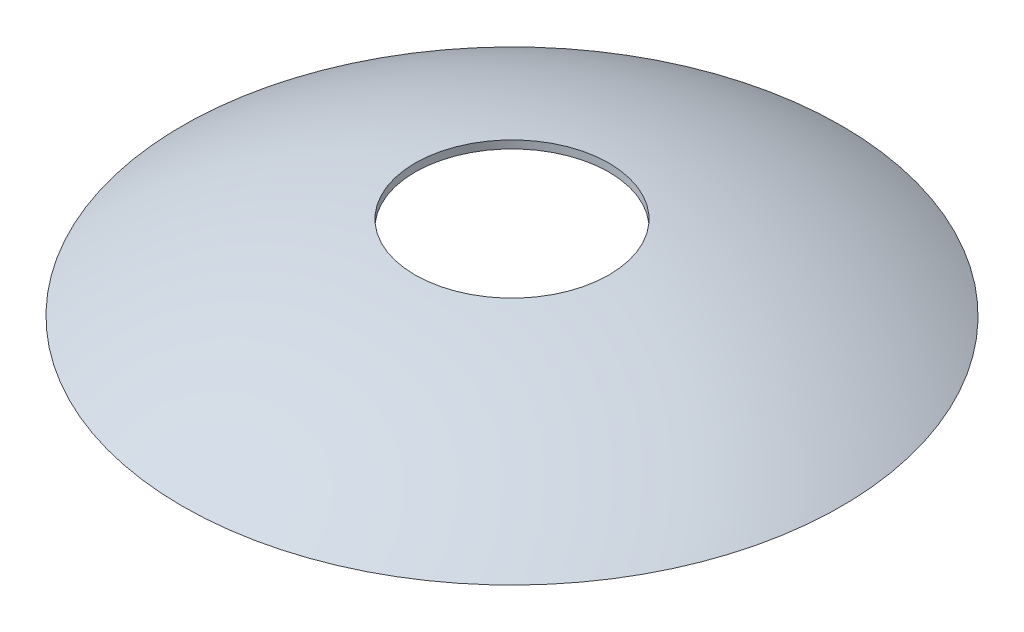
from build123d import *

# Parameters (mm, degrees)
SKETCH4_R          = 25
CUT_EXTRUDE1_DEPTH = 37.574958191


# Read off the part's stored shape, not the designer's step: Shell4
with BuildPart() as part:
    # Sketch2 → Revolve3 (revolve)
    with BuildSketch(Plane.XY):
        with BuildLine():
            ThreePointArc((-85, 0), (-44.249157481, 17.892673888), (0, 22.666666667))
            Line((0, 22.666666667), (0, 0))
            Line((0, 0), (-85, 0))
        make_face()
    revolve(axis=Axis((0, 22.666666667, 0), (0, -1, 0)))

    # Shell4 outline → Shell4 (revolve, cut)
    with BuildSketch(Plane.XY):
        with BuildLine():
            Line((0, 0), (81.209332356, 0))
            add(Edge.make_bspline(
                [(81.209332356, 0), (68.010422844, 7.99521566), (53.461432942, 14.388290113), (37.997575401, 18.722433384), (22.188288082, 20.818693148), (5.322203728, 20.818693133), (3.987860722, 20.803180878), (2.655815078, 20.772246575), (1.326414656, 20.725996375), (0, 20.664551338)],
                knots=[1.026160926, 1.026160926, 1.026160926, 1.026160926, 1.026160926, 1.026160926, 1.570268783, 1.570268783, 1.570268783, 1.570268783, 1.617087387, 1.617087387, 1.617087387, 1.617087387, 1.617087387, 1.617087387], degree=5, weights=[1, 1, 0.999461009, 0.999454119, 1, 1, 0.999999976, 0.999999977, 1, 1]))
            Line((0, 20.664551338), (0, 0))
        make_face()
    revolve(axis=Axis((0, 0, 0), (0, 1, 0)), mode=Mode.SUBTRACT)

    # Sketch4 → Cut-Extrude1 (cut)
    with BuildSketch(Plane(origin=(0, 0, 0), x_dir=(1, 0, 0), z_dir=(0, 1, 0))):
        with Locations(Location((0, 0, 0), (0, 0, 90))):
            Circle(SKETCH4_R)
    extrude(amount=CUT_EXTRUDE1_DEPTH, mode=Mode.SUBTRACT)


solid = part.part
